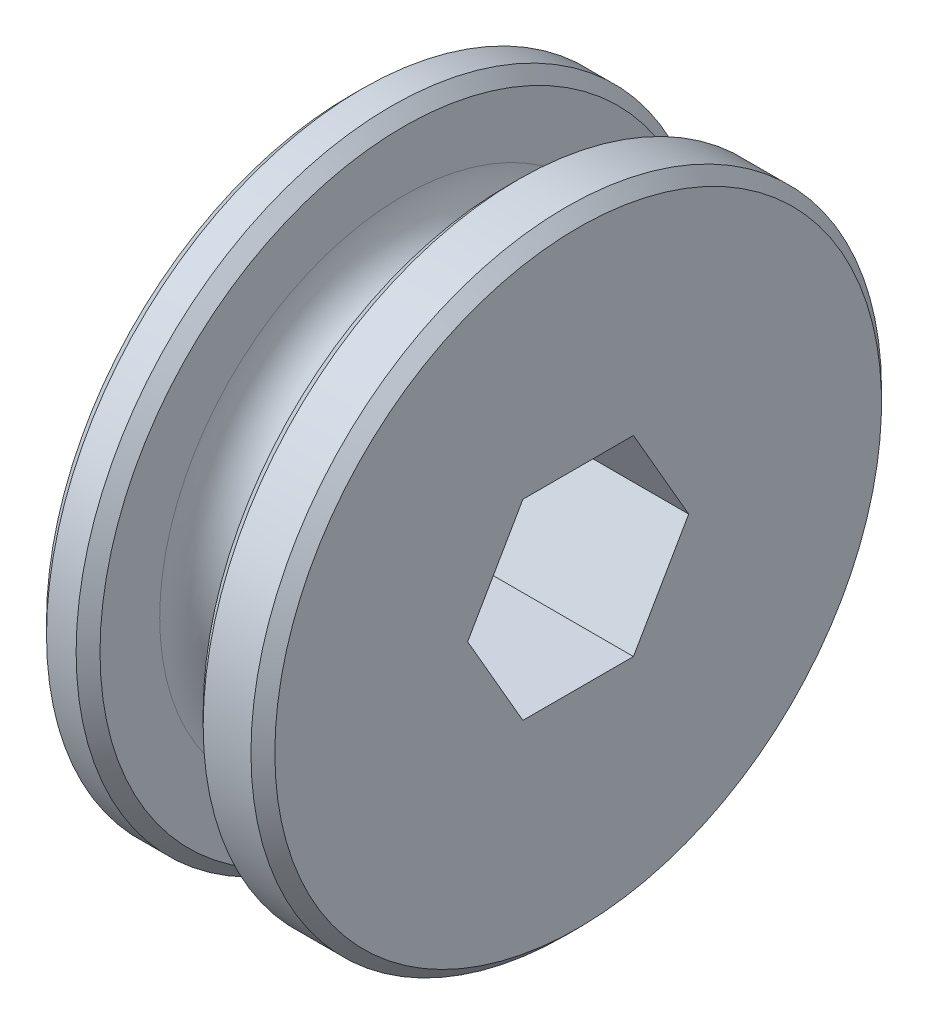
from build123d import *

# Parameters (mm, degrees)
CHAMFER1_SIZE      = 0.79375
CUT_EXTRUDE1_DEPTH = 34.294897541
CHAMFER2_SIZE      = 0.79375


with BuildPart() as part:
    # Sketch1 → Revolve1 (revolve)
    with BuildSketch(Plane.XY):
        with BuildLine():
            Line((0, 0), (15.1765, 0))
            Line((15.1765, 0), (15.1765, 20.955))
            Line((15.1765, 20.955), (10.414, 20.955))
            Line((10.414, 20.955), (10.414, 16.1925))
            ThreePointArc((10.414, 16.1925), (6.985, 12.7635), (3.556, 16.1925))
            Line((3.556, 16.1925), (3.556, 20.955))
            Line((3.556, 20.955), (0, 20.955))
            Line((0, 20.955), (0, 0))
        make_face()
    revolve(axis=Axis((0, 0, 0), (1, 0, 0)))

    # Chamfer1
    chamfer1_edges = [part.edges().sort_by_distance(p)[0] for p in [
        (0, -20.955, 0),
    ]]
    chamfer(chamfer1_edges, length=CHAMFER1_SIZE)

    # Sketch2 → Cut-Extrude1 (cut, through all)
    with BuildSketch(Plane.ZY):
        Polygon((3.673506558, -6.3627), (7.347013116, 0), (3.673506558, 6.3627), (-3.673506558, 6.3627), (-7.347013116, 0), (-3.673506558, -6.3627), align=None)
    extrude(amount=-CUT_EXTRUDE1_DEPTH, mode=Mode.SUBTRACT)

    # Chamfer2
    chamfer2_edges = [part.edges().sort_by_distance(p)[0] for p in [
        (15.1765, -20.955, 0),
        (10.414, -20.955, 0),
        (3.556, -20.955, 0),
    ]]
    chamfer(chamfer2_edges, length=CHAMFER2_SIZE)


solid = part.part
